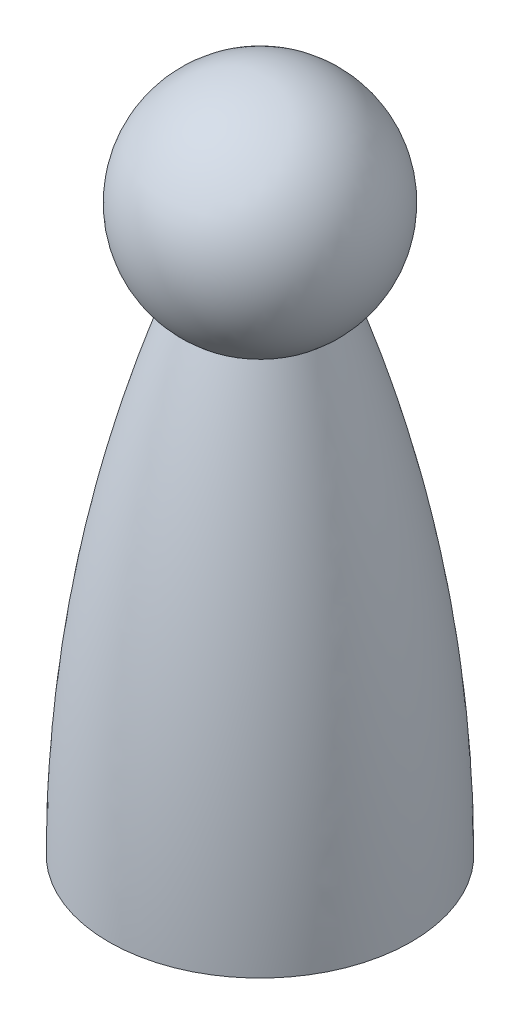
from build123d import *


with BuildPart() as part:
    # Sketch1 → Revolve1 (revolve)
    with BuildSketch(Plane(origin=(0, 0, 0), x_dir=(0, 0, -1), z_dir=(1, 0, 0))):
        with BuildLine():
            Line((0, 0), (12.7, 0))
            Line((12.7, 0), (12.7, 3.81))
            Line((12.7, 3.81), (19.05, 3.81))
            add(Edge.make_bspline(
                [(19.05, 3.81), (18.960707091, 34.874332984), (8.659504703, 63.9676153)],
                knots=[0, 0, 0, 1, 1, 1], degree=2))
            ThreePointArc((8.659504703, 63.9676153), (13.196693038, 79.513469523), (0, 88.9))
            Line((0, 88.9), (0, 0))
        make_face()
    revolve(axis=Axis((0, 0, 0), (0, 1, 0)))


solid = part.part
